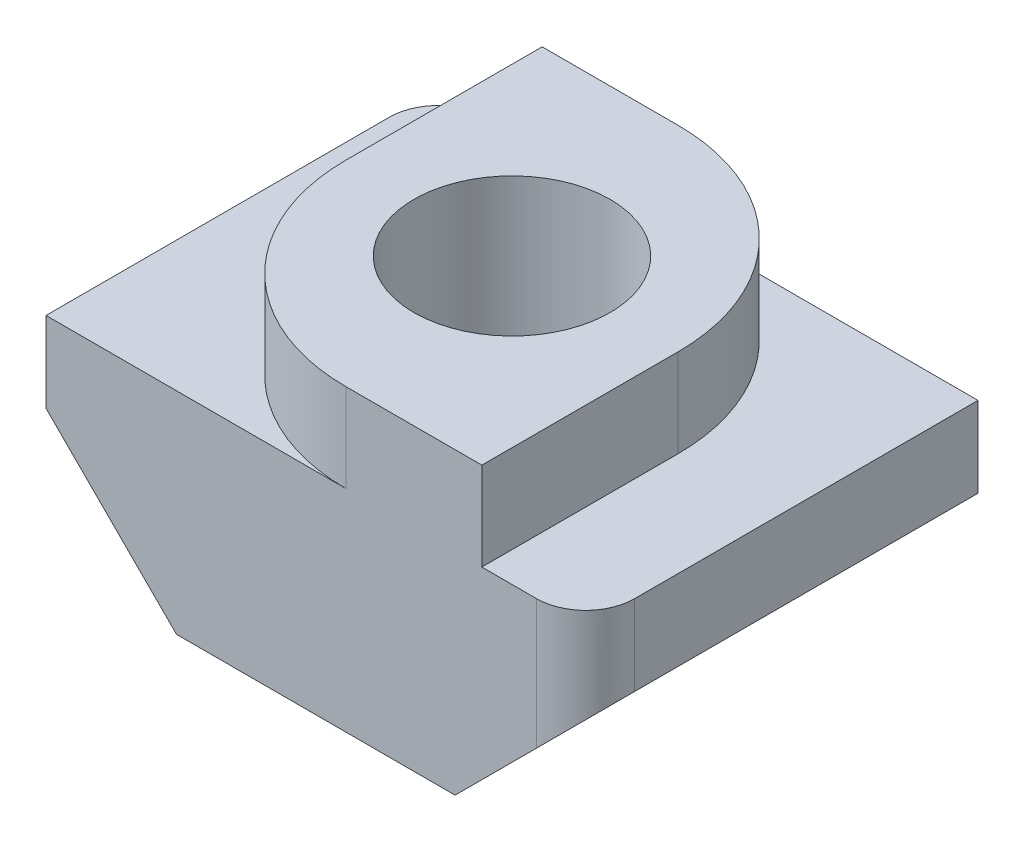
from build123d import *

# Parameters (mm, degrees)
SKETCH1_W           = 11
SKETCH1_H           = 8
SKETCH1_R           = 2
BOSS_EXTRUDE1_DEPTH = 4.3
CUT_EXTRUDE1_DEPTH  = 11.617909399
SKETCH3_W           = 6.77
SKETCH3_H           = 8
SKETCH3_R           = 2
BOSS_EXTRUDE2_DEPTH = 1.8
FILLET1_R           = 4
FILLET2_R           = 1


with BuildPart() as part:
    # Sketch1 → Boss-Extrude1 (new body)
    with BuildSketch(Plane(origin=(0, 0, 0), x_dir=(1, 0, 0), z_dir=(0, 1, 0))):
        Rectangle(SKETCH1_W, SKETCH1_H)
        Circle(SKETCH1_R, mode=Mode.SUBTRACT)
    extrude(amount=BOSS_EXTRUDE1_DEPTH)

    # Sketch2 → Cut-Extrude1 (cut, through all)
    with BuildSketch(Plane.XY.offset(4)):
        Polygon((-5.5, 2.66), (-2.84, 0), (-5.5, 0), align=None)
        Polygon((5.5, 2.66), (5.5, 0), (2.84, 0), align=None)
    extrude(amount=-CUT_EXTRUDE1_DEPTH, mode=Mode.SUBTRACT)

    # Sketch3 → Boss-Extrude2 (add)
    with BuildSketch(Plane(origin=(0, 4.3, 0), x_dir=(1, 0, 0), z_dir=(0, 1, 0))):
        Rectangle(SKETCH3_W, SKETCH3_H)
        Circle(SKETCH3_R, mode=Mode.SUBTRACT)
    extrude(amount=BOSS_EXTRUDE2_DEPTH)

    # Fillet1
    fillet1_edges = [part.edges().sort_by_distance(p)[0] for p in [
        (3.385, 5.2, -4),
        (-3.385, 5.2, 4),
    ]]
    fillet(fillet1_edges, radius=FILLET1_R)

    # Fillet2
    fillet2_edges = [part.edges().sort_by_distance(p)[0] for p in [
        (5.5, 3.48, 4),
        (-5.5, 3.48, -4),
    ]]
    fillet(fillet2_edges, radius=FILLET2_R)


solid = part.part
